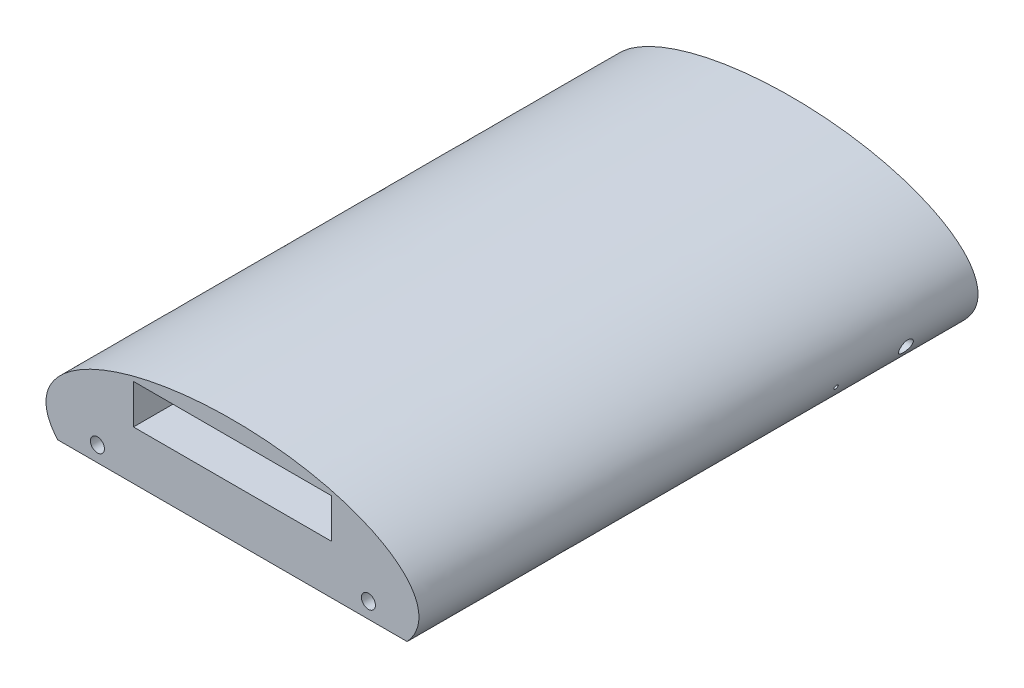
from build123d import *

# Parameters (mm, degrees)
SKETCH1_RX               = 240
SKETCH1_RY               = 100
SKETCH1_R                = 9
SKETCH1_W                = 254.8
SKETCH1_H                = 50.8
BOSS_EXTRUDE1_DEPTH      = 719.55
CUT_EXTRUDE1_DEPTH       = 766.083134372
CUT_EXTRUDE1_DEPTH_BACK  = 766.083134372
SKETCH7_W                = 152.4
SKETCH7_H                = 77
CUT_EXTRUDE2_DEPTH       = 144
CUT_EXTRUDE3_START       = -241
CUT_EXTRUDE3_OUTLINE_R   = 9
CUT_EXTRUDE3_OUTLINE_R_2 = 2.75
CUT_EXTRUDE3_DEPTH       = 482


with BuildPart() as part:
    # Sketch1 → Boss-Extrude1 (new body)
    with BuildSketch(Plane.XY):
        with Locations((0, 0)):
            Ellipse(SKETCH1_RX, SKETCH1_RY)
        with Locations((175, -15)):
            Circle(SKETCH1_R, mode=Mode.SUBTRACT)
        with Locations(Location((-173.785, -15, 0), (0, 0, 180))):
            Circle(SKETCH1_R, mode=Mode.SUBTRACT)
        with Locations((0, 53.5)):
            Rectangle(SKETCH1_W, SKETCH1_H, mode=Mode.SUBTRACT)
    extrude(amount=BOSS_EXTRUDE1_DEPTH)

    # Sketch3 → Cut-Extrude1 (cut, two sides: drawn at the far end of the back side and taken through both)
    with BuildSketch(Plane(origin=(0, 0, 0), x_dir=(0, 0, -1), z_dir=(1, 0, 0)).offset(-CUT_EXTRUDE1_DEPTH_BACK)):
        Polygon((-719.55, -100), (-719.55, -35), (-244.134429793, -100), align=None)
    extrude(amount=CUT_EXTRUDE1_DEPTH + CUT_EXTRUDE1_DEPTH_BACK, mode=Mode.SUBTRACT)

    # Sketch7 → Cut-Extrude2 (cut)
    with BuildSketch(Plane.XY):
        with Locations((0, -40.4)):
            Rectangle(SKETCH7_W, SKETCH7_H)
    extrude(amount=CUT_EXTRUDE2_DEPTH, mode=Mode.SUBTRACT)

    # Cut-Extrude3: read off the stored shape, not the designer's step
    # Cut-Extrude3 outline → Cut-Extrude3 (cut)
    with BuildSketch(Plane(origin=(0, 0, 0), x_dir=(0, 0, -1), z_dir=(1, 0, 0)).offset(CUT_EXTRUDE3_START)):
        with Locations((-90, -15)):
            Circle(CUT_EXTRUDE3_OUTLINE_R)
        with Locations((-180, -15)):
            Circle(CUT_EXTRUDE3_OUTLINE_R_2)
    extrude(amount=CUT_EXTRUDE3_DEPTH, mode=Mode.SUBTRACT)


solid = part.part
